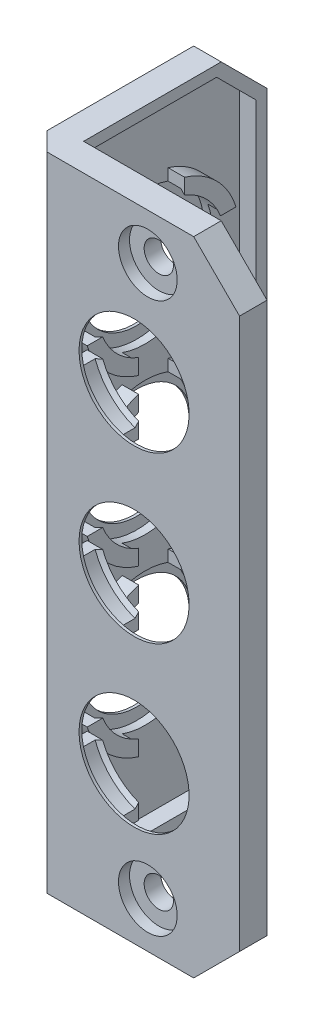
from build123d import *

# Parameters (mm, degrees)
EXTRUDE_THIN1_DEPTH     = 88.9
CHAMFER4_SIZE           = 2.54
CHAMFER1_SIZE           = 6.35
SKETCH2_R               = 9.2583
CUT_EXTRUDE1_DEPTH      = 3.429
SKETCH9_R               = 9.2583
SKETCH9_R_2             = 8.7503
EXTRUDE_THIN2_DEPTH     = 0.508
SKETCH4_R               = 7.62
CUT_EXTRUDE3_DEPTH      = 96.882897328
SKETCH3_R               = 9.2583
CUT_EXTRUDE2_DEPTH      = 3.429
SKETCH10_R              = 9.2583
SKETCH10_R_2            = 8.7503
EXTRUDE_THIN3_DEPTH     = 0.508
SKETCH5_R               = 7.62
CUT_EXTRUDE4_DEPTH      = 96.882897328
LPATTERN1_COUNT         = 3
LPATTERN1_PITCH         = 22.86
HOLE1_D                 = 4.064
HOLE1_CBORE_D           = 8.128
HOLE1_CBORE_DEPTH       = 1.524
SHELL1_START            = -23.876
SHELL1_OUTLINE_R        = 10.7823
SHELL1_DEPTH            = 26.162
SHELL1_2_OUTLINE_R      = 3.556
SHELL1_2_DEPTH          = 0.762
SHELL1_START_2          = -2.286
SHELL1_3_OUTLINE_R      = 10.7823
SHELL1_3_OUTLINE_R_2    = 9.2583
SHELL1_3_DEPTH          = 2.286
SHELL1_START_3          = -0.508
SHELL1_4_OUTLINE_R      = 9.2583
SHELL1_4_OUTLINE_R_2    = 8.7503
SHELL1_4_DEPTH          = 0.508
SHELL1_START_4          = -3.232892204
SHELL1_5_OUTLINE_W      = 2.32957951
SHELL1_5_OUTLINE_H      = 85.852
SHELL1_5_DEPTH          = 1.164789756
CHAMFER3_SIZE           = 0.508
CUT_EXTRUDE_THIN1_REACH = 97.883
SKETCH11_W              = 6.35
SKETCH11_H              = 67.2846
SKETCH11_W_2            = 21.5646
SKETCH11_H_2            = 6.35
CUT_EXTRUDE_THIN2_REACH = 97.883
SKETCH13_W              = 6.35
SKETCH13_H              = 67.2846
SKETCH13_W_2            = 21.5646
SKETCH13_H_2            = 6.35


with BuildPart() as part:
    # Sketch1 → Extrude-Thin1 (new body)
    with BuildSketch(Plane(origin=(0, 0, 0), x_dir=(1, 0, 0), z_dir=(0, 1, 0))):
        Polygon((0, 25.4), (0, 0), (25.4, 0), (25.4, -3.81), (-3.81, -3.81), (-3.81, 25.4), align=None)
    extrude(amount=EXTRUDE_THIN1_DEPTH)

    # Chamfer4
    chamfer4_edges = [part.edges().sort_by_distance(p)[0] for p in [
        (-3.81, 44.45, 3.81),
    ]]
    chamfer(chamfer4_edges, length=CHAMFER4_SIZE)

    # Chamfer1
    chamfer1_edges = [part.edges().sort_by_distance(p)[0] for p in [
        (-1.905, 88.9, -25.4),
        (-1.905, 0, -25.4),
        (25.4, 0, 1.905),
        (25.4, 88.9, 1.905),
    ]]
    chamfer(chamfer1_edges, length=CHAMFER1_SIZE)

    # Sketch2 → Cut-Extrude1 (cut)
    with BuildSketch(Plane(origin=(0, 0, 0), x_dir=(-1, 0, 0), z_dir=(0, 0, -1))):
        with Locations((-10.795, 67.31)):
            Circle(SKETCH2_R)
    cut_extrude1 = extrude(amount=-CUT_EXTRUDE1_DEPTH, mode=Mode.SUBTRACT)

    # Sketch9 → Extrude-Thin2 (add)
    with BuildSketch(Plane(origin=(0, 0, 0), x_dir=(-1, 0, 0), z_dir=(0, 0, -1))):
        with Locations((-10.795, 67.31)):
            Circle(SKETCH9_R)
        with Locations((-10.795, 67.31)):
            Circle(SKETCH9_R_2, mode=Mode.SUBTRACT)
    extrude_thin2 = extrude(amount=-EXTRUDE_THIN2_DEPTH)

    # Sketch4 → Cut-Extrude3 (cut, through all)
    with BuildSketch(Plane(origin=(0, 0, 0), x_dir=(-1, 0, 0), z_dir=(0, 0, -1))):
        with Locations((-10.795, 67.31)):
            Circle(SKETCH4_R)
    cut_extrude3 = extrude(amount=-CUT_EXTRUDE3_DEPTH, mode=Mode.SUBTRACT)

    # Sketch3 → Cut-Extrude2 (cut)
    with BuildSketch(Plane(origin=(0, 0, 0), x_dir=(0, 0, -1), z_dir=(1, 0, 0))):
        with Locations((10.795, 67.31)):
            Circle(SKETCH3_R)
    cut_extrude2 = extrude(amount=-CUT_EXTRUDE2_DEPTH, mode=Mode.SUBTRACT)

    # Sketch10 → Extrude-Thin3 (add)
    with BuildSketch(Plane(origin=(0, 0, 0), x_dir=(0, 0, -1), z_dir=(1, 0, 0))):
        with Locations((10.795, 67.31)):
            Circle(SKETCH10_R)
        with Locations((10.795, 67.31)):
            Circle(SKETCH10_R_2, mode=Mode.SUBTRACT)
    extrude_thin3 = extrude(amount=-EXTRUDE_THIN3_DEPTH)

    # Sketch5 → Cut-Extrude4 (cut, through all)
    with BuildSketch(Plane(origin=(0, 0, 0), x_dir=(0, 0, -1), z_dir=(1, 0, 0))):
        with Locations((10.795, 67.31)):
            Circle(SKETCH5_R)
    cut_extrude4 = extrude(amount=-CUT_EXTRUDE4_DEPTH, mode=Mode.SUBTRACT)

    # LPattern1: Cut-Extrude1, Extrude-Thin2, Cut-Extrude3, Cut-Extrude2, Extrude-Thin3, Cut-Extrude4 ×3
    with Locations(*[(0, -i * LPATTERN1_PITCH, 0) for i in range(1, LPATTERN1_COUNT)]):
        add(cut_extrude1, mode=Mode.SUBTRACT)
        add(extrude_thin2)
        add(cut_extrude3, mode=Mode.SUBTRACT)
        add(cut_extrude2, mode=Mode.SUBTRACT)
        add(extrude_thin3)
        add(cut_extrude4, mode=Mode.SUBTRACT)

    # Hole1 (through all)
    with Locations(Plane.XY.offset(3.81)):
        with Locations((12.7, 82.55), (12.7, 6.35)):
            CounterBoreHole(HOLE1_D / 2, HOLE1_CBORE_D / 2, HOLE1_CBORE_DEPTH)

    # Shell1: read off the stored shape, not the designer's step
    # Shell1 outline → Shell1 (cut)
    with BuildSketch(Plane.XY.offset(SHELL1_START)):
        with BuildLine():
            ThreePointArc((15.516996273, 87.376), (18.271143767, 82.116293733), (14.736188344, 77.346185915))
            ThreePointArc((14.736188344, 77.346185915), (9.457620281, 56.61096225), (9.445524753, 78.007518864))
            ThreePointArc((9.445524753, 78.007518864), (7.11808265, 82.810658205), (9.883003727, 87.376))
            Line((9.883003727, 87.376), (-2.286, 87.376))
            Line((-2.286, 87.376), (-2.286, 1.524))
            Line((-2.286, 1.524), (9.883003727, 1.524))
            ThreePointArc((9.883003727, 1.524), (7.11808265, 6.089341795), (9.445524753, 10.892481136))
            ThreePointArc((9.445524753, 10.892481136), (9.457620281, 32.28903775), (14.736188344, 11.553814085))
            ThreePointArc((14.736188344, 11.553814085), (18.271143767, 6.783706267), (15.516996273, 1.524))
            Line((15.516996273, 1.524), (18.418738531, 1.524))
            Line((18.418738531, 1.524), (23.876, 6.981261469))
            Line((23.876, 6.981261469), (23.876, 81.918738531))
            Line((23.876, 81.918738531), (18.418738531, 87.376))
            Line((18.418738531, 87.376), (15.516996273, 87.376))
        make_face()
        with Locations((10.795, 44.45)):
            Circle(SHELL1_OUTLINE_R, mode=Mode.SUBTRACT)
    extrude(amount=SHELL1_DEPTH, mode=Mode.SUBTRACT)

    # Shell1 2 outline → Shell1 2 (cut)
    # profile 1 of 2: a face of its own
    with BuildSketch(Plane.XY):
        with BuildLine():
            ThreePointArc((9.445524753, 78.007518864), (12.132379719, 78.00903775), (14.736188344, 77.346185915))
            ThreePointArc((14.736188344, 77.346185915), (18.271143767, 82.116293733), (15.516996273, 87.376))
            Line((15.516996273, 87.376), (9.883003727, 87.376))
            ThreePointArc((9.883003727, 87.376), (7.11808265, 82.810658205), (9.445524753, 78.007518864))
        make_face()
        with Locations((12.7, 82.55)):
            Circle(SHELL1_2_OUTLINE_R, mode=Mode.SUBTRACT)
    # profile 2 of 2: a face of its own
    with BuildSketch(Plane.XY):
        with BuildLine():
            ThreePointArc((9.445524753, 10.892481136), (7.11808265, 6.089341795), (9.883003727, 1.524))
            Line((9.883003727, 1.524), (15.516996273, 1.524))
            ThreePointArc((15.516996273, 1.524), (18.271143767, 6.783706267), (14.736188344, 11.553814085))
            ThreePointArc((14.736188344, 11.553814085), (12.132379719, 10.89096225), (9.445524753, 10.892481136))
        make_face()
        with Locations((12.7, 6.35)):
            Circle(SHELL1_2_OUTLINE_R, mode=Mode.SUBTRACT)
    extrude(amount=SHELL1_2_DEPTH, mode=Mode.SUBTRACT)

    # Shell1 3 outline → Shell1 3 (add)
    # profile 1 of 5: a face of its own
    with BuildSketch(Plane.YZ.offset(SHELL1_START_2)):
        Polygon((1.524, -20.574), (4.826, -23.876), (6.981261469, -23.876), (1.524, -18.418738531), align=None)
    # profile 2 of 5: a face of its own
    with BuildSketch(Plane.YZ.offset(SHELL1_START_2)):
        Polygon((87.376, -18.418738531), (81.918738531, -23.876), (84.074, -23.876), (87.376, -20.574), align=None)
    # profile 3 of 5: a face of its own
    with BuildSketch(Plane.YZ.offset(SHELL1_START_2)):
        with Locations((44.45, -10.795)):
            Circle(SHELL1_3_OUTLINE_R)
        with Locations((44.45, -10.795)):
            Circle(SHELL1_3_OUTLINE_R_2, mode=Mode.SUBTRACT)
    # profile 4 of 5: a face of its own
    with BuildSketch(Plane.YZ.offset(SHELL1_START_2)):
        with Locations((21.59, -10.795)):
            Circle(SHELL1_3_OUTLINE_R)
        with Locations((21.59, -10.795)):
            Circle(SHELL1_3_OUTLINE_R_2, mode=Mode.SUBTRACT)
    # profile 5 of 5: a face of its own
    with BuildSketch(Plane.YZ.offset(SHELL1_START_2)):
        with Locations((67.31, -10.795)):
            Circle(SHELL1_3_OUTLINE_R)
        with Locations((67.31, -10.795)):
            Circle(SHELL1_3_OUTLINE_R_2, mode=Mode.SUBTRACT)
    extrude(amount=SHELL1_3_DEPTH)

    # Shell1 4 outline → Shell1 4 (add)
    # profile 1 of 3: a face of its own
    with BuildSketch(Plane.YZ.offset(SHELL1_START_3)):
        with Locations((67.31, -10.795)):
            Circle(SHELL1_4_OUTLINE_R)
        with Locations((67.31, -10.795)):
            Circle(SHELL1_4_OUTLINE_R_2, mode=Mode.SUBTRACT)
    # profile 2 of 3: a face of its own
    with BuildSketch(Plane.YZ.offset(SHELL1_START_3)):
        with Locations((44.45, -10.795)):
            Circle(SHELL1_4_OUTLINE_R)
        with Locations((44.45, -10.795)):
            Circle(SHELL1_4_OUTLINE_R_2, mode=Mode.SUBTRACT)
    # profile 3 of 3: a face of its own
    with BuildSketch(Plane.YZ.offset(SHELL1_START_3)):
        with Locations((21.59, -10.795)):
            Circle(SHELL1_4_OUTLINE_R)
        with Locations((21.59, -10.795)):
            Circle(SHELL1_4_OUTLINE_R_2, mode=Mode.SUBTRACT)
    extrude(amount=SHELL1_4_DEPTH)

    # Shell1 5 outline → Shell1 5 (add)
    with BuildSketch(Plane(origin=(0, 0, 0), x_dir=(0.707106781186546, 0, 0.707106781186549), z_dir=(0.707106781186549, 0, -0.707106781186546)).offset(SHELL1_START_4)):
        with Locations((0, -44.45)):
            Rectangle(SHELL1_5_OUTLINE_W, SHELL1_5_OUTLINE_H)
    extrude(amount=SHELL1_5_DEPTH)

    # Chamfer3
    chamfer3_edges = [part.edges().sort_by_distance(p)[0] for p in [
        (-0.508, 35.6997, -10.795),
        (-0.508, 12.8397, -10.795),
        (19.5453, 67.31, 0.508),
        (-0.508, 58.5597, -10.795),
        (19.5453, 44.45, 0.508),
        (19.5453, 21.59, 0.508),
    ]]
    chamfer(chamfer3_edges, length=CHAMFER3_SIZE - 0.0001)  # a hair under: the kernel refuses the full size

    # Cut-Extrude-Thin1: up to this face of the body (flat: up to its plane)
    cut_extrude_thin1_end = Plane(part.part.faces().sort_by_distance((16.967867402, 86.483165284, 2.286))[0])
    # Sketch11 → Cut-Extrude-Thin1 (cut, up to the picked face)
    with BuildSketch(Plane(origin=(0, 0, 0), x_dir=(-1, 0, 0), z_dir=(0, 0, -1)), mode=Mode.PRIVATE) as cut_extrude_thin1_sk1:
        with Locations((-10.795, 44.45)):
            Rectangle(SKETCH11_W, SKETCH11_H)
    cut_extrude_thin1_tool1 = split(extrude(cut_extrude_thin1_sk1.sketch, amount=-CUT_EXTRUDE_THIN1_REACH, mode=Mode.PRIVATE), bisect_by=cut_extrude_thin1_end, keep=Keep.BOTH, mode=Mode.PRIVATE)
    # Sketch11 → Cut-Extrude-Thin1 (cut, up to the picked face)
    with BuildSketch(Plane(origin=(0, 0, 0), x_dir=(-1, 0, 0), z_dir=(0, 0, -1)), mode=Mode.PRIVATE) as cut_extrude_thin1_sk2:
        with Locations((-10.795, 21.59)):
            Rectangle(SKETCH11_W_2, SKETCH11_H_2)
    cut_extrude_thin1_tool2 = split(extrude(cut_extrude_thin1_sk2.sketch, amount=-CUT_EXTRUDE_THIN1_REACH, mode=Mode.PRIVATE), bisect_by=cut_extrude_thin1_end, keep=Keep.BOTH, mode=Mode.PRIVATE)
    # Sketch11 → Cut-Extrude-Thin1 (cut, up to the picked face)
    with BuildSketch(Plane(origin=(0, 0, 0), x_dir=(-1, 0, 0), z_dir=(0, 0, -1)), mode=Mode.PRIVATE) as cut_extrude_thin1_sk3:
        with Locations((-10.795, 44.45)):
            Rectangle(SKETCH11_W_2, SKETCH11_H_2)
    cut_extrude_thin1_tool3 = split(extrude(cut_extrude_thin1_sk3.sketch, amount=-CUT_EXTRUDE_THIN1_REACH, mode=Mode.PRIVATE), bisect_by=cut_extrude_thin1_end, keep=Keep.BOTH, mode=Mode.PRIVATE)
    # Sketch11 → Cut-Extrude-Thin1 (cut, up to the picked face)
    with BuildSketch(Plane(origin=(0, 0, 0), x_dir=(-1, 0, 0), z_dir=(0, 0, -1)), mode=Mode.PRIVATE) as cut_extrude_thin1_sk4:
        with Locations((-10.795, 67.31)):
            Rectangle(SKETCH11_W_2, SKETCH11_H_2)
    cut_extrude_thin1_tool4 = split(extrude(cut_extrude_thin1_sk4.sketch, amount=-CUT_EXTRUDE_THIN1_REACH, mode=Mode.PRIVATE), bisect_by=cut_extrude_thin1_end, keep=Keep.BOTH, mode=Mode.PRIVATE)
    add(cut_extrude_thin1_tool1.solids().sort_by(Axis((10.795, 44.45, 0), (0, 0, 1)))[0], mode=Mode.SUBTRACT)
    add(cut_extrude_thin1_tool2.solids().sort_by(Axis((10.795, 21.59, 0), (0, 0, 1)))[0], mode=Mode.SUBTRACT)
    add(cut_extrude_thin1_tool3.solids().sort_by(Axis((10.795, 44.45, 0), (0, 0, 1)))[0], mode=Mode.SUBTRACT)
    add(cut_extrude_thin1_tool4.solids().sort_by(Axis((10.795, 67.31, 0), (0, 0, 1)))[0], mode=Mode.SUBTRACT)

    # Cut-Extrude-Thin2: up to this face of the body (flat: up to its plane)
    cut_extrude_thin2_end = Plane(part.part.faces().sort_by_distance((-2.286, 84.016039783, -20.516039783))[0])
    # Sketch13 → Cut-Extrude-Thin2 (cut, up to the picked face)
    with BuildSketch(Plane(origin=(0, 0, 0), x_dir=(0, 0, -1), z_dir=(1, 0, 0)), mode=Mode.PRIVATE) as cut_extrude_thin2_sk1:
        with Locations((10.795, 44.45)):
            Rectangle(SKETCH13_W, SKETCH13_H)
    cut_extrude_thin2_tool1 = split(extrude(cut_extrude_thin2_sk1.sketch, amount=-CUT_EXTRUDE_THIN2_REACH, mode=Mode.PRIVATE), bisect_by=cut_extrude_thin2_end, keep=Keep.BOTH, mode=Mode.PRIVATE)
    # Sketch13 → Cut-Extrude-Thin2 (cut, up to the picked face)
    with BuildSketch(Plane(origin=(0, 0, 0), x_dir=(0, 0, -1), z_dir=(1, 0, 0)), mode=Mode.PRIVATE) as cut_extrude_thin2_sk2:
        with Locations((10.795, 21.59)):
            Rectangle(SKETCH13_W_2, SKETCH13_H_2)
    cut_extrude_thin2_tool2 = split(extrude(cut_extrude_thin2_sk2.sketch, amount=-CUT_EXTRUDE_THIN2_REACH, mode=Mode.PRIVATE), bisect_by=cut_extrude_thin2_end, keep=Keep.BOTH, mode=Mode.PRIVATE)
    # Sketch13 → Cut-Extrude-Thin2 (cut, up to the picked face)
    with BuildSketch(Plane(origin=(0, 0, 0), x_dir=(0, 0, -1), z_dir=(1, 0, 0)), mode=Mode.PRIVATE) as cut_extrude_thin2_sk3:
        with Locations((10.795, 44.45)):
            Rectangle(SKETCH13_W_2, SKETCH13_H_2)
    cut_extrude_thin2_tool3 = split(extrude(cut_extrude_thin2_sk3.sketch, amount=-CUT_EXTRUDE_THIN2_REACH, mode=Mode.PRIVATE), bisect_by=cut_extrude_thin2_end, keep=Keep.BOTH, mode=Mode.PRIVATE)
    # Sketch13 → Cut-Extrude-Thin2 (cut, up to the picked face)
    with BuildSketch(Plane(origin=(0, 0, 0), x_dir=(0, 0, -1), z_dir=(1, 0, 0)), mode=Mode.PRIVATE) as cut_extrude_thin2_sk4:
        with Locations((10.795, 67.31)):
            Rectangle(SKETCH13_W_2, SKETCH13_H_2)
    cut_extrude_thin2_tool4 = split(extrude(cut_extrude_thin2_sk4.sketch, amount=-CUT_EXTRUDE_THIN2_REACH, mode=Mode.PRIVATE), bisect_by=cut_extrude_thin2_end, keep=Keep.BOTH, mode=Mode.PRIVATE)
    add(cut_extrude_thin2_tool1.solids().sort_by(Axis((0, 44.45, -10.795), (-1, 0, 0)))[0], mode=Mode.SUBTRACT)
    add(cut_extrude_thin2_tool2.solids().sort_by(Axis((0, 21.59, -10.795), (-1, 0, 0)))[0], mode=Mode.SUBTRACT)
    add(cut_extrude_thin2_tool3.solids().sort_by(Axis((0, 44.45, -10.795), (-1, 0, 0)))[0], mode=Mode.SUBTRACT)
    add(cut_extrude_thin2_tool4.solids().sort_by(Axis((0, 67.31, -10.795), (-1, 0, 0)))[0], mode=Mode.SUBTRACT)


solid = part.part
